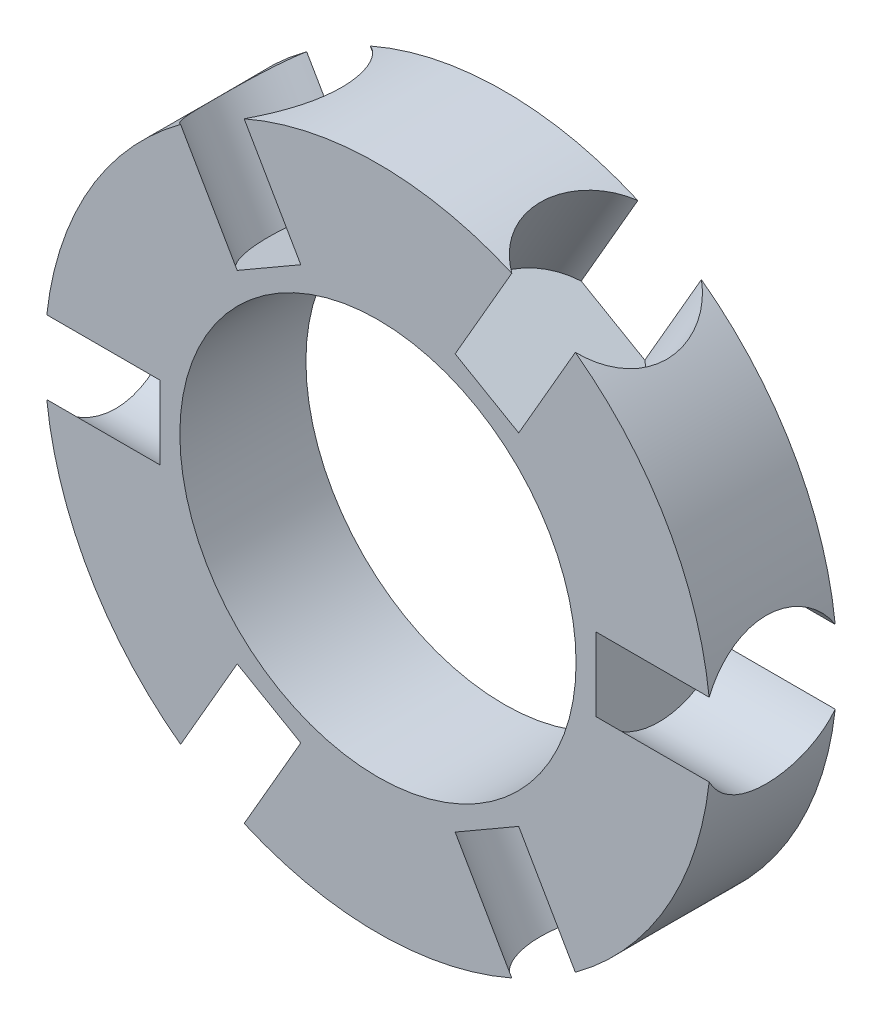
from build123d import *

# Parameters (mm, degrees)
SKETCH1_R           = 18.5
SKETCH1_R_2         = 11
BOSS_EXTRUDE1_DEPTH = 3.5
SKETCH2_R           = 4.05
CUT_EXTRUDE3_DEPTH  = 6.4
CIRPATTERN1_COUNT   = 6


with BuildPart() as part:
    # Sketch1 → Boss-Extrude1 (new, symmetric)
    with BuildSketch(Plane.XY):
        Circle(SKETCH1_R)
        Circle(SKETCH1_R_2, mode=Mode.SUBTRACT)
    extrude(amount=BOSS_EXTRUDE1_DEPTH, both=True)

    # Sketch2 → Cut-Extrude3 (cut)
    with BuildSketch(Plane(origin=(-18.5, -17.193061184, 0), x_dir=(0, -1, 0), z_dir=(1, 0, 0))):
        with Locations((-17.193061184, 0)):
            Circle(SKETCH2_R)
    cut_extrude3 = extrude(amount=CUT_EXTRUDE3_DEPTH, mode=Mode.SUBTRACT)

    # CirPattern1: Cut-Extrude3 ×6 about axis
    cirpattern1_axis = Axis((0, 0, 3.5), (0, 0, 1))
    for i in range(1, CIRPATTERN1_COUNT):
        add(cut_extrude3.rotate(cirpattern1_axis, i * 360 / CIRPATTERN1_COUNT), mode=Mode.SUBTRACT)


solid = part.part
